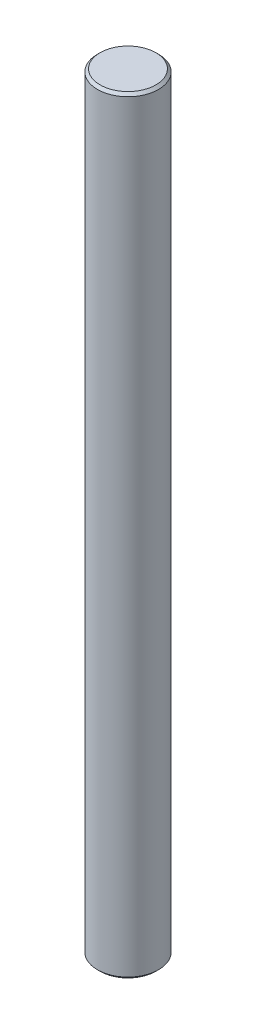
from build123d import *

# Parameters (mm, degrees)
SKETCH2_W          = 17.5
SKETCH2_H          = 440
CHAMFER1_SIZE      = 1.5
SKETCH3_R          = 0.5
CUT_EXTRUDE1_DEPTH = 3


with BuildPart() as part:
    # Sketch2 → Revolve1 (revolve)
    with BuildSketch(Plane.XY):
        with Locations((8.75, 220)):
            Rectangle(SKETCH2_W, SKETCH2_H)
    revolve(axis=Axis((0, 440, 0), (0, -1, 0)))

    # Chamfer1
    chamfer1_edges = [part.edges().sort_by_distance(p)[0] for p in [
        (-17.5, 0, 0),
        (-17.5, 440, 0),
    ]]
    chamfer(chamfer1_edges, length=CHAMFER1_SIZE)

    # Sketch3 → Cut-Extrude1 (cut)
    with BuildSketch(Plane.XZ):
        Circle(SKETCH3_R)
    extrude(amount=-CUT_EXTRUDE1_DEPTH, mode=Mode.SUBTRACT)


solid = part.part
